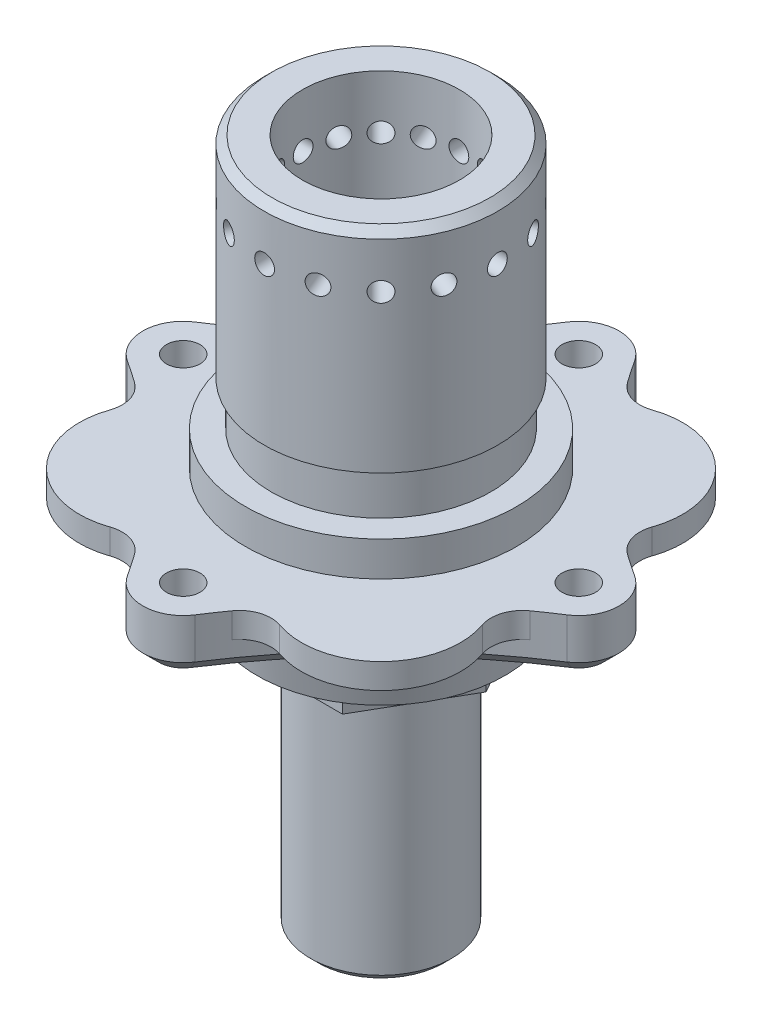
from build123d import *

# Parameters (mm, degrees)
SKETCH5_W                     = 15.875
SKETCH5_H                     = 79.375
DRIVE_PIN_HOLES_D             = 6.8
DRIVE_PIN_HOLES_PATTERN_COUNT = 4
FLANGE_START                  = -6.35
SKETCH8_R                     = 52.5
FLANGE_SUPPORT_CUT_DEPTH      = 6.35
SKETCH9_R                     = 52.5
FLORAL_PATTERN_CUT_DEPTH      = 106.665196995
SKETCH10_R                    = 25.0825
BRAKE_HAT_HEX_DEPTH           = 4.7625
M10_CLEARANCE_HOLE1_D         = 11
SKETCH14_R                    = 2
PIN_HOLES_DEPTH               = 98.561648779
PIN_HOLE_PATTERN_COUNT        = 16
FLORAL_PATTERN_CHAMFER_SIZE   = 3.175
FLORAL_PATTERN_FILLET_R       = 6.35


with BuildPart() as part:
    # Sketch1 → Bearing Shaft/Flange Support (revolve)
    with BuildSketch(Plane(origin=(0, 0, 0), x_dir=(0, 0, -1), z_dir=(1, 0, 0))):
        Polygon((0, 0), (-27.254672075, 0), (-25.0825, -12.319), (-25.0825, -17.0815), (-14.2875, -17.0815), (-14.2875, -67.2465), (-12.7, -68.834), (0, -68.834), align=None)
    revolve(axis=Axis((0, 0, 0), (0, 1, 0)))

    # Sketch2 → Drive Pin Support (revolve)
    with BuildSketch(Plane(origin=(0, 0, 0), x_dir=(0, 0, -1), z_dir=(1, 0, 0))):
        Polygon((0, 0), (-52.5, 0), (-52.5, 11.43), (-27.4096, 11.43), (-27.4096, 18.43), (-22.225, 18.43), (-22.225, 27.305), (-23.61946, 27.305), (-23.61946, 68.2625), (-22.03196, 69.85), (0, 69.85), align=None)
    revolve(axis=Axis((0, 0, 0), (0, 1, 0)))

    # Sketch5 → Center Mass Removal (revolve, cut)
    with BuildSketch(Plane(origin=(0, 0, 0), x_dir=(0, 0, -1), z_dir=(1, 0, 0))):
        with Locations((7.9375, 30.1625)):
            Rectangle(SKETCH5_W, SKETCH5_H)
    revolve(axis=Axis((0, 0, 0), (0, -1, 0)), mode=Mode.SUBTRACT)

    # Drive Pin Holes (through all)
    with Locations(Plane(origin=(0, 0, 0), x_dir=(-1, 0, 0), z_dir=(0, -1, 0))):
        with Locations((0, -40)):
            drive_pin_holes = Hole(DRIVE_PIN_HOLES_D / 2)

    # Drive Pin Holes Pattern: Drive Pin Holes ×4 about axis
    drive_pin_holes_pattern_axis = Axis((0, 0, 0), (0, -1, 0))
    for i in range(1, DRIVE_PIN_HOLES_PATTERN_COUNT):
        add(drive_pin_holes.rotate(drive_pin_holes_pattern_axis, i * 360 / DRIVE_PIN_HOLES_PATTERN_COUNT), mode=Mode.SUBTRACT)

    # Sketch8 → Flange Support Cut (cut)
    with BuildSketch(Plane.XZ.offset(FLANGE_START)):
        Circle(SKETCH8_R)
        with BuildLine():
            ThreePointArc((-6.851776468, 44.436165629), (0, 48.1625), (6.851776468, 44.436165629))
            ThreePointArc((6.851776468, 44.436165629), (23.655722013, 23.655722013), (44.436165629, 6.851776468))
            ThreePointArc((44.436165629, 6.851776468), (48.1625, 0), (44.436165629, -6.851776468))
            ThreePointArc((44.436165629, -6.851776468), (23.655722013, -23.655722013), (6.851776468, -44.436165629))
            ThreePointArc((6.851776468, -44.436165629), (0, -48.1625), (-6.851776468, -44.436165629))
            ThreePointArc((-6.851776468, -44.436165629), (-23.655722013, -23.655722013), (-44.436165629, -6.851776468))
            ThreePointArc((-44.436165629, -6.851776468), (-48.1625, 0), (-44.436165629, 6.851776468))
            ThreePointArc((-44.436165629, 6.851776468), (-23.655722013, 23.655722013), (-6.851776468, 44.436165629))
        make_face(mode=Mode.SUBTRACT)
    extrude(amount=FLANGE_SUPPORT_CUT_DEPTH, mode=Mode.SUBTRACT)

    # Sketch9 → Floral Pattern Cut (cut, through all)
    with BuildSketch(Plane.XZ.offset(-6.35)):
        Circle(SKETCH9_R)
        with BuildLine():
            ThreePointArc((-44.436165629, -6.851776468), (-48.1625, 0), (-44.436165629, 6.851776468))
            ThreePointArc((-44.436165629, 6.851776468), (-39.943623391, 9.89866373), (-35.585386853, 13.13474655))
            ThreePointArc((-35.585386853, 13.13474655), (-33.837199119, 33.837199119), (-13.13474655, 35.585386853))
            ThreePointArc((-13.13474655, 35.585386853), (-9.89866373, 39.943623391), (-6.851776468, 44.436165629))
            ThreePointArc((-6.851776468, 44.436165629), (0, 48.1625), (6.851776468, 44.436165629))
            ThreePointArc((6.851776468, 44.436165629), (9.89866373, 39.943623391), (13.13474655, 35.585386853))
            ThreePointArc((13.13474655, 35.585386853), (33.837199119, 33.837199119), (35.585386853, 13.13474655))
            ThreePointArc((35.585386853, 13.13474655), (39.943623391, 9.89866373), (44.436165629, 6.851776468))
            ThreePointArc((44.436165629, 6.851776468), (48.1625, 0), (44.436165629, -6.851776468))
            ThreePointArc((44.436165629, -6.851776468), (39.943623391, -9.89866373), (35.585386852, -13.13474655))
            ThreePointArc((35.585386852, -13.13474655), (33.837199119, -33.837199119), (13.13474655, -35.585386853))
            ThreePointArc((13.13474655, -35.585386853), (9.89866373, -39.943623391), (6.851776468, -44.436165629))
            ThreePointArc((6.851776468, -44.436165629), (0, -48.1625), (-6.851776468, -44.436165629))
            ThreePointArc((-6.851776468, -44.436165629), (-9.89866373, -39.943623391), (-13.13474655, -35.585386853))
            ThreePointArc((-13.13474655, -35.585386853), (-33.837199119, -33.837199119), (-35.585386853, -13.13474655))
            ThreePointArc((-35.585386853, -13.13474655), (-39.943623391, -9.89866373), (-44.436165629, -6.851776468))
        make_face(mode=Mode.SUBTRACT)
    extrude(amount=-FLORAL_PATTERN_CUT_DEPTH, mode=Mode.SUBTRACT)

    # Sketch10 → Brake Hat Hex (cut)
    with BuildSketch(Plane.XZ.offset(17.0815)):
        Circle(SKETCH10_R)
        Polygon((10.631905207, -18.415), (21.263810414, 0), (10.631905207, 18.415), (-10.631905207, 18.415), (-21.263810414, 0), (-10.631905207, -18.415), align=None, mode=Mode.SUBTRACT)
    extrude(amount=-BRAKE_HAT_HEX_DEPTH, mode=Mode.SUBTRACT)

    # M10 Clearance Hole1 (through all)
    with Locations(Plane(origin=(0, -68.834, 0), x_dir=(-1, 0, 0), z_dir=(0, -1, 0))):
        with Locations((0, 0)):
            Hole(M10_CLEARANCE_HOLE1_D / 2)

    # Sketch14 → Pin Holes (cut, through all)
    with BuildSketch(Plane(origin=(0, 0, 0), x_dir=(0, 0, -1), z_dir=(1, 0, 0))):
        with Locations((0, 59.05)):
            Circle(SKETCH14_R)
    pin_holes = extrude(amount=-PIN_HOLES_DEPTH, mode=Mode.SUBTRACT)

    # Pin Hole Pattern: Pin Holes ×16 about axis
    pin_hole_pattern_axis = Axis((0, 0, 0), (0, -1, 0))
    for i in range(1, PIN_HOLE_PATTERN_COUNT):
        add(pin_holes.rotate(pin_hole_pattern_axis, i * 360 / PIN_HOLE_PATTERN_COUNT), mode=Mode.SUBTRACT)

    # Floral Pattern Chamfer
    floral_pattern_chamfer_edges = [part.edges().sort_by_distance(p)[0] for p in [
        (0, 0, -48.1625),
        (23.655722013, 0, -23.655722013),
        (48.1625, 0, 0),
        (-23.655722013, 0, -23.655722013),
        (-48.1625, 0, 0),
        (-23.655722013, 0, 23.655722013),
        (0, 0, 48.1625),
        (23.655722013, 0, 23.655722013),
    ]]
    chamfer(floral_pattern_chamfer_edges, length=FLORAL_PATTERN_CHAMFER_SIZE)

    # Floral Pattern Fillet
    floral_pattern_fillet_edges = [part.edges().sort_by_distance(p)[0] for p in [
        (-35.585386853, 8.89, 13.13474655),
        (-35.585386853, 8.89, -13.13474655),
        (-13.13474655, 8.89, -35.585386853),
        (13.13474655, 8.89, -35.585386853),
        (35.585386852, 8.89, -13.13474655),
        (35.585386853, 8.89, 13.13474655),
        (-13.13474655, 8.89, 35.585386853),
        (13.13474655, 8.89, 35.585386853),
    ]]
    fillet(floral_pattern_fillet_edges, radius=FLORAL_PATTERN_FILLET_R)


solid = part.part
